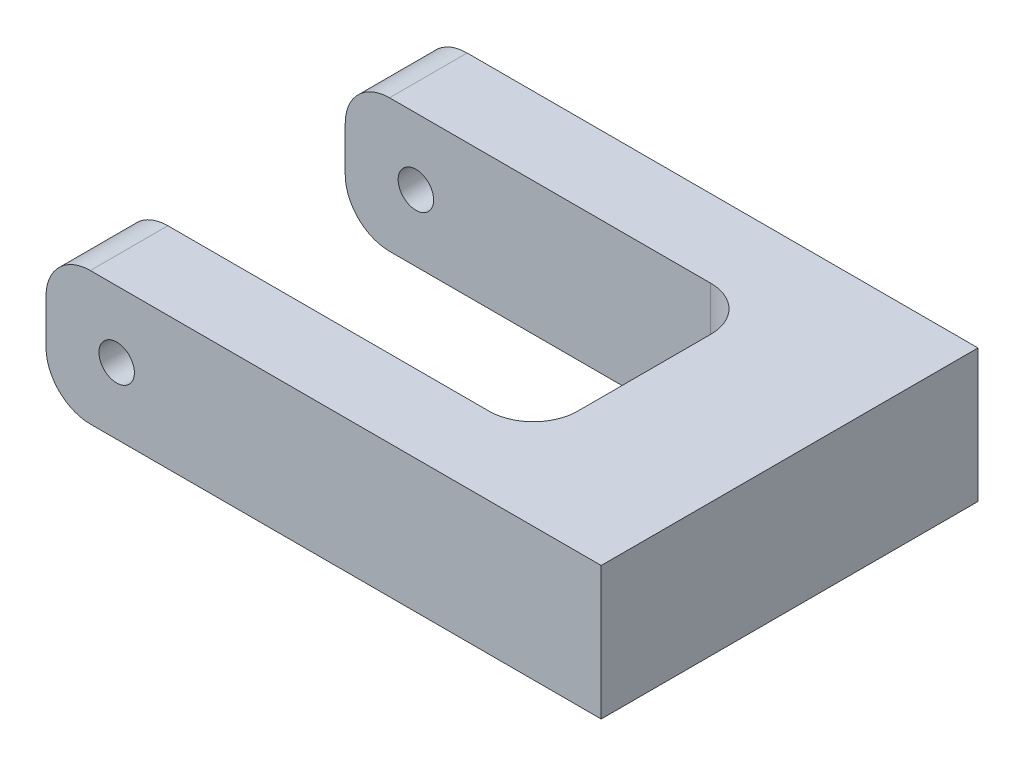
from build123d import *

# Parameters (mm, degrees)
EXTRUDE_START       = 7.5
EXTRUDE_1_DEPTH     = 85
SKETCH_3_W          = 94.594294475
SKETCH_3_H          = 50
CUT_EXTRUDE_1_DEPTH = 43.5
SKETCH_4_R          = 4
CUT_EXTRUDE_2_DEPTH = 100
FILLET_1_R          = 10


with BuildPart() as part:
    # Эскиз1 → Вытянуть1 (new body)
    with BuildSketch(Plane.XY.offset(EXTRUDE_START)):
        with BuildLine():
            Line((-0.114856082, -4.041900761), (-0.114856082, -14.041900761))
            ThreePointArc((-0.114856082, -14.041900761), (2.814076106, -21.112968573), (9.885143918, -24.041900761))
            Line((9.885143918, -24.041900761), (125.131658012, -24.041900761))
            Line((125.131658012, -24.041900761), (125.131658012, 5.958099239))
            Line((125.131658012, 5.958099239), (9.885143918, 5.958099239))
            ThreePointArc((9.885143918, 5.958099239), (2.814076106, 3.02916705), (-0.114856082, -4.041900761))
        make_face()
    extrude(amount=-EXTRUDE_1_DEPTH)

    # Эскиз3 → Вырез-Вытянуть1 (cut, symmetric)
    with BuildSketch(Plane(origin=(0, 0, 0), x_dir=(1, 0, 0), z_dir=(0, 1, 0))):
        with Locations((45.031047777, 35)):
            Rectangle(SKETCH_3_W, SKETCH_3_H)
    extrude(amount=CUT_EXTRUDE_1_DEPTH, both=True, mode=Mode.SUBTRACT)

    # Эскиз4 → Вырез-Вытянуть2 (cut, symmetric)
    with BuildSketch(Plane.XY):
        with Locations((15.823953055, -9.041900761)):
            Circle(SKETCH_4_R)
    extrude(amount=CUT_EXTRUDE_2_DEPTH, both=True, mode=Mode.SUBTRACT)

    # Скругление1
    fillet_1_edges = [part.edges().sort_by_distance(p)[0] for p in [
        (92.328195015, -9.041900761, -10),
        (92.328195015, -9.041900761, -60),
    ]]
    fillet(fillet_1_edges, radius=FILLET_1_R)


solid = part.part
